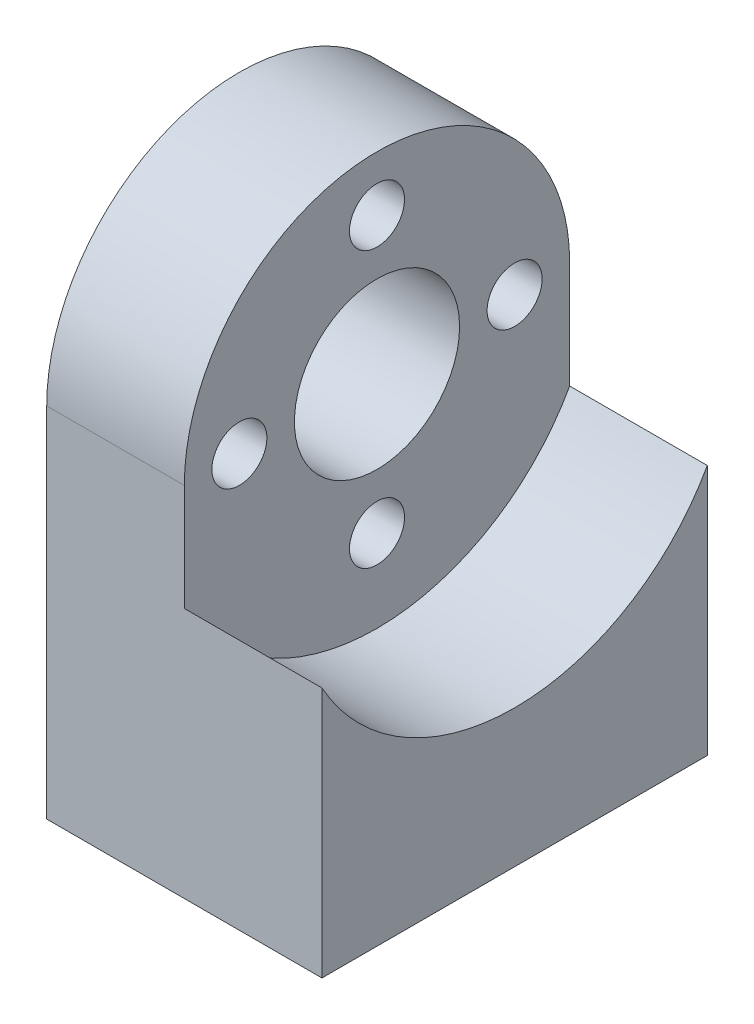
from build123d import *

# Parameters (mm, degrees)
SKETCH1_R                       = 3
SKETCH1_R_2                     = 1
BOSS_EXTRUDE1_DEPTH             = 10
SKETCH2_R                       = 8
CUT_EXTRUDE1_DEPTH              = 5
CIRPATTERN1_OUTLINE_R           = 1
CIRPATTERN1_DEPTH               = 5
TAP_DRILL_FOR_M3X0_5_TAP1_D     = 2.5
TAP_DRILL_FOR_M3X0_5_TAP1_DEPTH = 4
TAP_DRILL_FOR_M3X0_5_TAP1_TIP   = 0.751075774
SKETCH5_R                       = 1
CUT_EXTRUDE2_DEPTH              = 4
CHAMFER1_SIZE                   = 1


# Read off the part's stored shape, not the designer's step: CirPattern1
with BuildPart() as part:
    # Sketch1 → Boss-Extrude1 (new body)
    with BuildSketch(Plane(origin=(0, 0, 0), x_dir=(0, 0, -1), z_dir=(1, 0, 0))):
        with BuildLine():
            Line((0, 13), (0, 0))
            Line((0, 0), (14, 0))
            Line((14, 0), (14, 13))
            ThreePointArc((14, 13), (7, 20), (0, 13))
        make_face()
        with Locations((7, 13)):
            Circle(SKETCH1_R, mode=Mode.SUBTRACT)
        with Locations((12, 13)):
            Circle(SKETCH1_R_2, mode=Mode.SUBTRACT)
    extrude(amount=BOSS_EXTRUDE1_DEPTH)

    # Sketch2 → Cut-Extrude1 (cut)
    with BuildSketch(Plane(origin=(10, 0, 0), x_dir=(0, 0, -1), z_dir=(1, 0, 0))):
        with Locations((7, 13)):
            Circle(SKETCH2_R)
    extrude(amount=-CUT_EXTRUDE1_DEPTH, mode=Mode.SUBTRACT)

    # CirPattern1 outline → CirPattern1 (cut)
    with BuildSketch(Plane.YZ):
        with Locations((8, -7)):
            Circle(CIRPATTERN1_OUTLINE_R)
        with Locations((13, -2)):
            Circle(CIRPATTERN1_OUTLINE_R)
        with Locations((18, -7)):
            Circle(CIRPATTERN1_OUTLINE_R)
    extrude(amount=CIRPATTERN1_DEPTH, mode=Mode.SUBTRACT)

    # Tap Drill for M3x0.5 Tap1
    with Locations(Plane(origin=(0, 0, 0), x_dir=(-1, 0, 0), z_dir=(0, -1, 0))):
        with Locations((-3, 11), (-7, 3)):
            Hole(TAP_DRILL_FOR_M3X0_5_TAP1_D / 2, depth=TAP_DRILL_FOR_M3X0_5_TAP1_DEPTH)
            with Locations((0, 0, -(TAP_DRILL_FOR_M3X0_5_TAP1_DEPTH + TAP_DRILL_FOR_M3X0_5_TAP1_TIP / 2))):  # 118° drill point
                Cone(0, TAP_DRILL_FOR_M3X0_5_TAP1_D / 2, TAP_DRILL_FOR_M3X0_5_TAP1_TIP, mode=Mode.SUBTRACT)

    # Sketch5 → Cut-Extrude2 (cut)
    with BuildSketch(Plane.XZ):
        with Locations(Location((3, -3, 0), (0, 0, 270))):
            Circle(SKETCH5_R)
        with Locations(Location((7, -11, 0), (0, 0, 270))):
            Circle(SKETCH5_R)
    extrude(amount=-CUT_EXTRUDE2_DEPTH, mode=Mode.SUBTRACT)

    # Chamfer1
    chamfer1_edges = [part.edges().sort_by_distance(p)[0] for p in [
        (0, 13, -11),
        (0, 17, -7),
        (0, 12, -2),
        (0, 7, -7),
    ]]
    chamfer(chamfer1_edges, length=CHAMFER1_SIZE - 0.0001)  # a hair under: the kernel refuses the full size


solid = part.part
